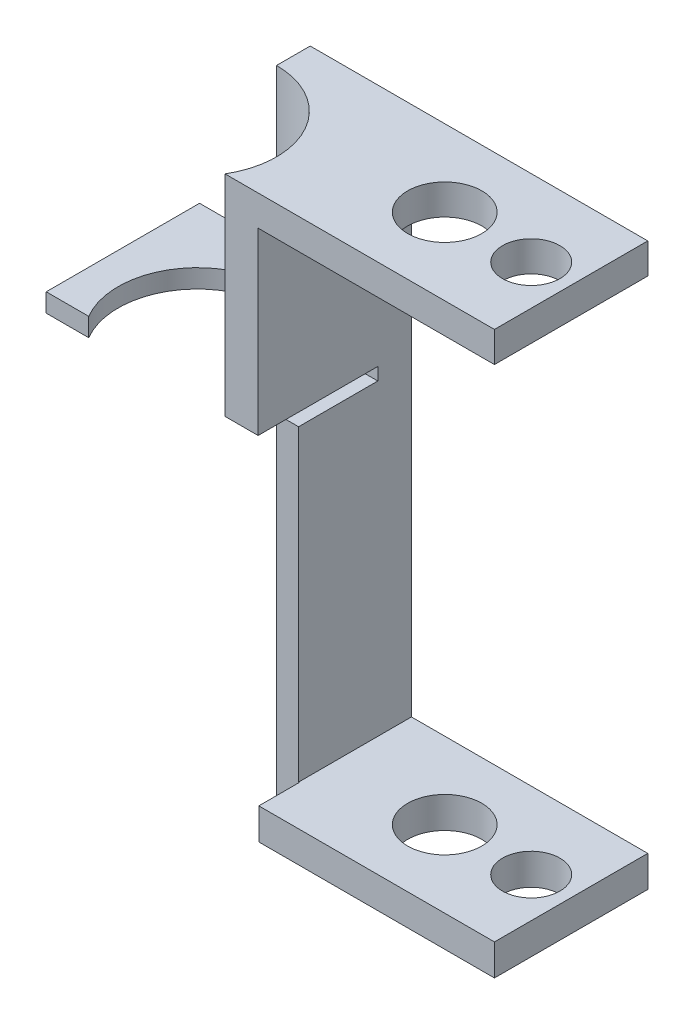
from build123d import *

# Parameters (mm, degrees)
SKETCH1_W              = 1526.54
SKETCH1_H              = 693.42
SKETCH1_R              = 129.54
SKETCH1_R_2            = 167.64
BOSS_EXTRUDE1_DEPTH    = 2540
SKETCH6_W              = 1068.621988509
SKETCH6_H              = 2260.925218267
CUT_EXTRUDE1_DEPTH     = 2540
CUT_EXTRUDE2_START     = -1590.133899231
CUT_EXTRUDE2_OUTLINE_W = 457.2
CUT_EXTRUDE2_OUTLINE_H = 182.88
CUT_EXTRUDE2_DEPTH     = 1590.133899231
SKETCH21_W             = 358.24
SKETCH21_H             = 57
CUT_EXTRUDE3_DEPTH     = 572.124
SKETCH22_W             = 693.42
SKETCH22_H             = 83.82
BOSS_EXTRUDE3_DEPTH    = 500.38
CUT_EXTRUDE4_DEPTH     = 2616.2
SKETCH24_R             = 358.25
CUT_EXTRUDE5_DEPTH     = 2616.2
SKETCH25_W             = 3.793020403
SKETCH25_H             = 182.88
CUT_EXTRUDE7_DEPTH     = 1590.294
SCALE1_SCALE           = 0.03937


# Read off the part's stored shape, not the designer's step: Cut-Extrude2
with BuildPart() as part:
    # Sketch1 → Boss-Extrude1 (new body)
    with BuildSketch(Plane(origin=(0, 0, 0), x_dir=(1, 0, 0), z_dir=(0, 1, 0))):
        with Locations((763.27, 346.71)):
            Rectangle(SKETCH1_W, SKETCH1_H)
        with Locations(Location((1346.125866933, 346.71, 0), (0, 0, 90))):
            Circle(SKETCH1_R, mode=Mode.SUBTRACT)
        with Locations(Location((954.97060339, 346.71, 0), (0, 0, 90))):
            Circle(SKETCH1_R_2, mode=Mode.SUBTRACT)
    extrude(amount=BOSS_EXTRUDE1_DEPTH)

    # Sketch6 → Cut-Extrude1 (cut)
    with BuildSketch(Plane.XY):
        with Locations((992.229005746, 1271.841969381)):
            Rectangle(SKETCH6_W, SKETCH6_H)
    extrude(amount=-CUT_EXTRUDE1_DEPTH, mode=Mode.SUBTRACT)

    # Cut-Extrude2 outline → Cut-Extrude2 (cut)
    with BuildSketch(Plane.XZ.offset(CUT_EXTRUDE2_START)):
        with Locations((228.6, -91.44)):
            Rectangle(CUT_EXTRUDE2_OUTLINE_W, CUT_EXTRUDE2_OUTLINE_H)
    extrude(amount=CUT_EXTRUDE2_DEPTH, mode=Mode.SUBTRACT)

    # Sketch21 → Cut-Extrude3 (cut)
    with BuildSketch(Plane.ZY):
        with Locations((-362, 1561.633899231)):
            Rectangle(SKETCH21_W, SKETCH21_H)
    extrude(amount=-CUT_EXTRUDE3_DEPTH, mode=Mode.SUBTRACT)

    # Sketch22 → Boss-Extrude3 (add)
    with BuildSketch(Plane.ZY):
        with Locations((-346.71, 1632.043899231)):
            Rectangle(SKETCH22_W, SKETCH22_H)
    extrude(amount=BOSS_EXTRUDE3_DEPTH)

    # Sketch23 → Cut-Extrude4 (cut)
    with BuildSketch(Plane.XZ):
        with BuildLine():
            Line((343.932135816, -182.88), (358.25, -182.88))
            ThreePointArc((358.25, -182.88), (-253.32100436, 70.44100436), (0, -541.13))
            Line((0, -541.13), (0, -182.88))
            Line((0, -182.88), (343.932135816, -182.88))
        make_face()
    extrude(amount=-CUT_EXTRUDE4_DEPTH, mode=Mode.SUBTRACT)

    # Sketch24 → Cut-Extrude5 (cut)
    with BuildSketch(Plane.XZ):
        with Locations((0, -182.88)):
            Circle(SKETCH24_R)
    extrude(amount=-CUT_EXTRUDE5_DEPTH, mode=Mode.SUBTRACT)

    # Sketch25 → Cut-Extrude7 (cut)
    with BuildSketch(Plane.XZ):
        with Locations((459.096510201, -91.44)):
            Rectangle(SKETCH25_W, SKETCH25_H)
    extrude(amount=-CUT_EXTRUDE7_DEPTH, mode=Mode.SUBTRACT)


with BuildPart() as part_1:
    # Scale1: scaled about (485.081829704, 1303.748157577, -445.917993823)
    add(part.part.scale(SCALE1_SCALE).moved(Location((465.984158069, 1252.419592613, -428.362202406))))


solid = part_1.part
